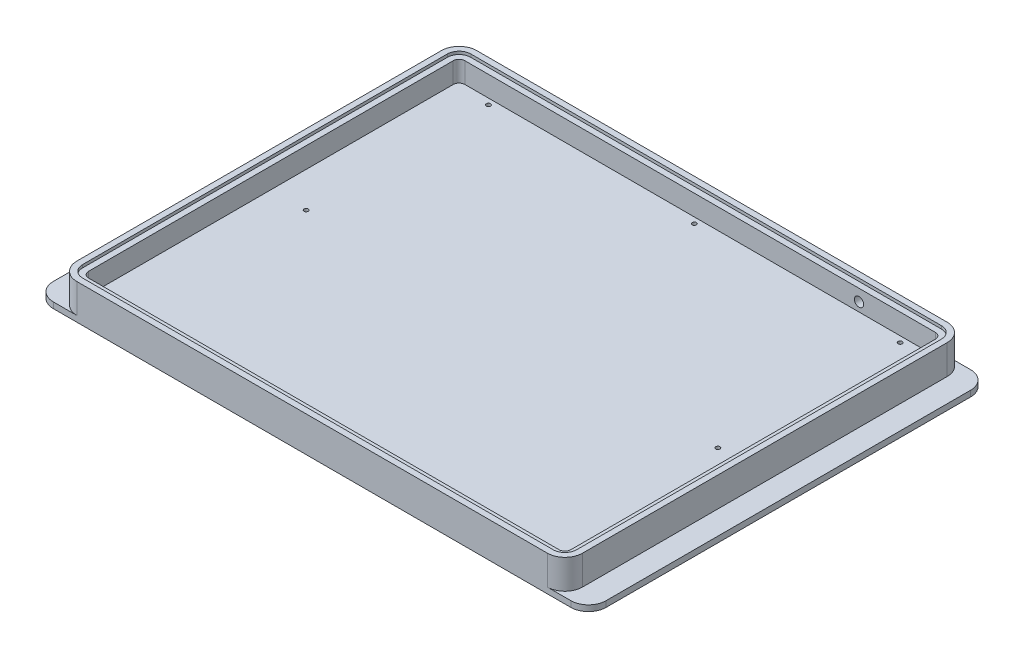
from build123d import *

# Parameters (mm, degrees)
SKETCH1_W           = 273.05
SKETCH1_H           = 215.9
BOSS_EXTRUDE1_DEPTH = 19.05
FILLET1_R           = 9.525
CUT_EXTRUDE1_DEPTH  = 12.7
CUT_EXTRUDE2_DEPTH  = 1.5875
SKETCH5_R           = 1.1303
CUT_EXTRUDE3_DEPTH  = 4.7625
SKETCH6_R           = 2.5
CUT_EXTRUDE4_DEPTH  = 12.7
BOSS_EXTRUDE2_DEPTH = 3.175


with BuildPart() as part:
    # Sketch1 → Boss-Extrude1 (new body)
    with BuildSketch(Plane(origin=(0, 0, 0), x_dir=(1, 0, 0), z_dir=(0, 1, 0))):
        with Locations((136.525, 107.95)):
            Rectangle(SKETCH1_W, SKETCH1_H)
    extrude(amount=BOSS_EXTRUDE1_DEPTH)

    # Fillet1
    fillet1_edges = [part.edges().sort_by_distance(p)[0] for p in [
        (273.05, 9.525, 0),
        (273.05, 9.525, -215.9),
        (0, 9.525, 0),
        (0, 9.525, -215.9),
    ]]
    fillet(fillet1_edges, radius=FILLET1_R)

    # Sketch3 → Cut-Extrude1 (cut)
    with BuildSketch(Plane(origin=(0, 19.05, 0), x_dir=(1, 0, 0), z_dir=(0, 1, 0))):
        with BuildLine():
            Line((266.7, 9.525), (266.7, 206.375))
            ThreePointArc((266.7, 206.375), (265.77006403, 208.62006403), (263.525, 209.55))
            Line((263.525, 209.55), (9.525, 209.55))
            ThreePointArc((9.525, 209.55), (7.27993597, 208.62006403), (6.35, 206.375))
            Line((6.35, 206.375), (6.35, 9.525))
            ThreePointArc((6.35, 9.525), (7.27993597, 7.27993597), (9.525, 6.35))
            Line((9.525, 6.35), (263.525, 6.35))
            ThreePointArc((263.525, 6.35), (265.77006403, 7.27993597), (266.7, 9.525))
        make_face()
    extrude(amount=-CUT_EXTRUDE1_DEPTH, mode=Mode.SUBTRACT)

    # Sketch4 → Cut-Extrude2 (cut)
    with BuildSketch(Plane(origin=(0, 19.05, 0), x_dir=(1, 0, 0), z_dir=(0, 1, 0))):
        with BuildLine():
            Line((269.875, 9.525), (269.875, 206.375))
            ThreePointArc((269.875, 206.375), (268.015128061, 210.865128061), (263.525, 212.725))
            Line((263.525, 212.725), (9.525, 212.725))
            ThreePointArc((9.525, 212.725), (5.034871939, 210.865128061), (3.175, 206.375))
            Line((3.175, 206.375), (3.175, 9.525))
            ThreePointArc((3.175, 9.525), (5.034871939, 5.034871939), (9.525, 3.175))
            Line((9.525, 3.175), (263.525, 3.175))
            ThreePointArc((263.525, 3.175), (268.015128061, 5.034871939), (269.875, 9.525))
        make_face()
    extrude(amount=-CUT_EXTRUDE2_DEPTH, mode=Mode.SUBTRACT)

    # Sketch5 → Cut-Extrude3 (cut)
    with BuildSketch(Plane(origin=(0, 6.35, 0), x_dir=(1, 0, 0), z_dir=(0, 1, 0))):
        with Locations((25.4, 206.375)):
            Circle(SKETCH5_R)
        with Locations((136.525, 206.375)):
            Circle(SKETCH5_R)
        with Locations((247.65, 206.375)):
            Circle(SKETCH5_R)
        with Locations((247.65, 107.95)):
            Circle(SKETCH5_R)
        with Locations((25.4, 107.95)):
            Circle(SKETCH5_R)
        with Locations((25.4, 9.525)):
            Circle(SKETCH5_R)
        with Locations((136.525, 9.525)):
            Circle(SKETCH5_R)
        with Locations((247.65, 9.525)):
            Circle(SKETCH5_R)
    extrude(amount=-CUT_EXTRUDE3_DEPTH, mode=Mode.SUBTRACT)

    # Sketch6 → Cut-Extrude4 (cut)
    with BuildSketch(Plane(origin=(0, 0, -215.9), x_dir=(-1, 0, 0), z_dir=(0, 0, -1))):
        with Locations((-222.25, 11.1125)):
            Circle(SKETCH6_R)
    extrude(amount=-CUT_EXTRUDE4_DEPTH, mode=Mode.SUBTRACT)

    # Sketch7 → Boss-Extrude2 (add)
    with BuildSketch(Plane.XZ):
        with BuildLine():
            Line((-3.175, 0), (276.225, 0))
            ThreePointArc((276.225, 0), (282.960192091, -2.789807909), (285.75, -9.525))
            Line((285.75, -9.525), (285.75, -206.375))
            ThreePointArc((285.75, -206.375), (282.960192091, -213.110192091), (276.225, -215.9))
            Line((276.225, -215.9), (-3.175, -215.9))
            ThreePointArc((-3.175, -215.9), (-9.910192091, -213.110192091), (-12.7, -206.375))
            Line((-12.7, -206.375), (-12.7, -9.525))
            ThreePointArc((-12.7, -9.525), (-9.910192091, -2.789807909), (-3.175, 0))
        make_face()
    extrude(amount=-BOSS_EXTRUDE2_DEPTH)


solid = part.part
